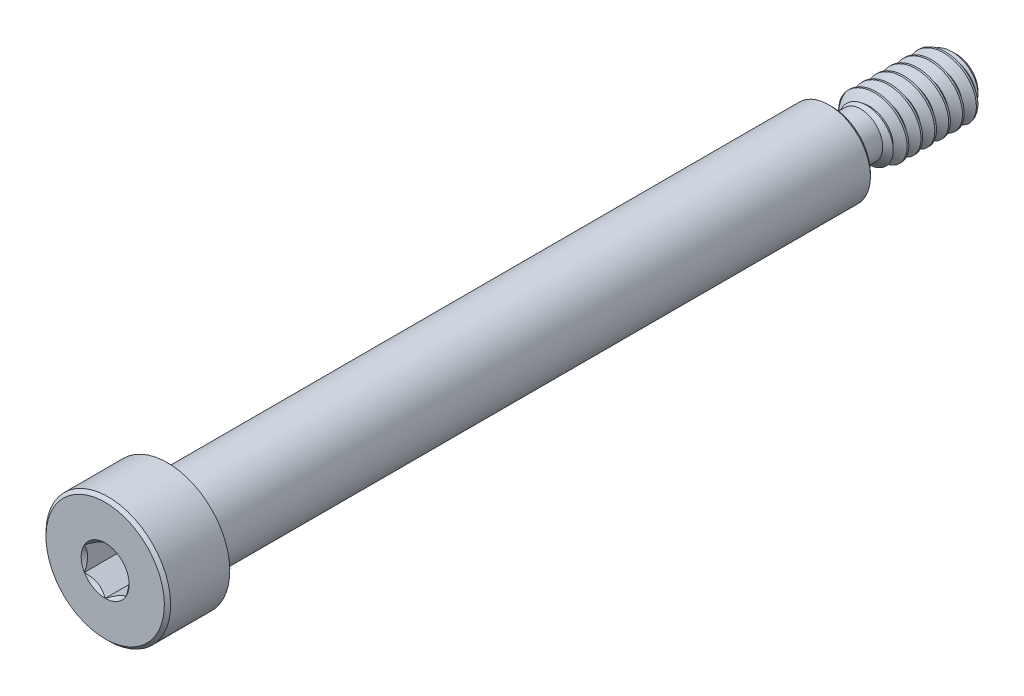
from build123d import *

# Parameters (mm, degrees)
CUT_EXTRUDE1_DEPTH = 3.571875
FILLET1_R          = 0.079375
CUT_SWEEP1_PITCH   = 1.058333333


with BuildPart() as part:
    # Sketch4 → Revolve1 (revolve)
    with BuildSketch(Plane(origin=(0, 0, 0), x_dir=(0, 0, -1), z_dir=(1, 0, 0)), mode=Mode.PRIVATE) as revolve1_sk:
        Polygon((-27.78125, 4.7625), (-32.305625, 4.7625), (-32.54375, 4.524375), (-32.54375, 0), (23.01875, 0), (23.01875, 2.921), (22.76475, 3.175), (-27.78125, 3.175), align=None)
    revolve(revolve1_sk.sketch.rotate(Axis((0, 0, 32.54375), (0, 0, -1)), 180), axis=Axis((0, 0, 32.54375), (0, 0, -1)))

    # Sketch5 → Cut-Extrude1 (cut)
    with BuildSketch(Plane.XY.offset(32.54375)):
        Polygon((1.5875, 0.916543552), (0, 1.833087105), (-1.5875, 0.916543552), (-1.5875, -0.916543552), (0, -1.833087105), (1.5875, -0.916543552), align=None)
    extrude(amount=-CUT_EXTRUDE1_DEPTH, mode=Mode.SUBTRACT)

    # Cut-Extrude4 cone 1 section (through the dimple's axis) → Cut-Extrude4 (revolve, cut)
    with BuildSketch(Plane(origin=(0, 0, 32.54375), x_dir=(0, -1, 0), z_dir=(1, 0, 0))):
        Polygon((0, 0), (1.833087105, 0), (0, 1.833087105), align=None)
    revolve(axis=Axis((0, 0, 32.54375), (0, 0, -1)), mode=Mode.SUBTRACT)

    # Sketch7 → Revolve2 (revolve)
    with BuildSketch(Plane(origin=(0, 0, 0), x_dir=(0, 0, -1), z_dir=(1, 0, 0))):
        Polygon((23.01875, 2.413), (31.75, 2.413), (32.54375, 1.61925), (32.54375, 0), (23.01875, 0), align=None)
    revolve(axis=Axis((0, 0, -32.54375), (0, 0, 1)))

    # Sketch10 → Cut-Revolve1 (revolve, cut)
    with BuildSketch(Plane(origin=(0, 0, 0), x_dir=(0, 0, -1), z_dir=(1, 0, 0))):
        with BuildLine():
            Line((23.3807, 1.6891), (25.1952125, 1.6891))
            Line((25.1952125, 1.6891), (26.6811125, 3.175))
            Line((26.6811125, 3.175), (23.01875, 3.175))
            Line((23.01875, 3.175), (23.01875, 2.05105))
            ThreePointArc((23.01875, 2.05105), (23.124762701, 1.795112701), (23.3807, 1.6891))
        make_face()
        Polygon((-27.78125, 3.175), (-27.46375, 3.175), (-27.6225, 3.01625), (-27.78125, 3.01625), align=None)
    revolve(axis=Axis((0, 0, -32.54375), (0, 0, 1)), mode=Mode.SUBTRACT)

    # Fillet1
    fillet1_edges = [part.edges().sort_by_distance(p)[0] for p in [
        (0, -3.01625, 27.78125),
    ]]
    fillet(fillet1_edges, radius=FILLET1_R)

    # Cut-Sweep1: the profile of Sketch9 screwed along a right-hand helix of 7.9435 turns, 8 arcs to a turn; built about Z, then put on its axis
    cut_sweep1_z = Axis((0, 0, 0), (0, 0, 1))
    cut_sweep1_corners = [(1.725592336, 0, -0.396875), (1.725592336, 0, -0.529166667), (2.470283972, 0, -0.959114583), (2.470283972, 0, 0.033072917)]
    with BuildLine(mode=Mode.PRIVATE) as cut_sweep1_profile:
        Line(cut_sweep1_corners[0], cut_sweep1_corners[1])
        Line(cut_sweep1_corners[1], cut_sweep1_corners[2])
        Line(cut_sweep1_corners[2], cut_sweep1_corners[3])
        Line(cut_sweep1_corners[3], cut_sweep1_corners[0])
    cut_sweep1_cap = Face(cut_sweep1_profile.wire())
    cut_sweep1_turn_angles = [0, 22.5, 45, 67.5, 90, 112.5, 135, 157.5, 180, 202.5, 225, 247.5, 270, 292.5, 315, 337.5, 360]
    cut_sweep1_turn_weights = [1, 0.9238795325112867, 1, 0.9238795325112867, 1, 0.9238795325112867, 1, 0.9238795325112867, 1, 0.9238795325112867, 1, 0.9238795325112867, 1, 0.9238795325112867, 1, 0.9238795325112867, 1]
    cut_sweep1_turn_rails = [Edge.make_bspline([Vector(p[0], p[1], 0).rotate(cut_sweep1_z, cut_sweep1_turn_angles[k]) / cut_sweep1_turn_weights[k] + Vector(0, 0, p[2] + CUT_SWEEP1_PITCH * cut_sweep1_turn_angles[k] / 360) for k in range(17)], [0, 0, 0, 1, 1, 2, 2, 3, 3, 4, 4, 5, 5, 6, 6, 7, 7, 8, 8, 8], 2, cut_sweep1_turn_weights) for p in cut_sweep1_corners]
    cut_sweep1_turn_sides = [Face.make_surface_from_curves(cut_sweep1_turn_rails[p[0]], cut_sweep1_turn_rails[p[1]]) for p in [(0, 1), (1, 2), (2, 3), (3, 0)]]
    cut_sweep1_last_angles = [2520, 2542.5, 2565, 2587.5, 2610, 2632.5, 2655, 2677.5, 2700, 2722.5, 2745, 2767.5, 2790, 2812.5, 2835, 2847.33, 2859.66]
    cut_sweep1_last_weights = [1, 0.9238795325112867, 1, 0.9238795325112867, 1, 0.9238795325112867, 1, 0.9238795325112867, 1, 0.9238795325112867, 1, 0.9238795325112867, 1, 0.9238795325112867, 1, 0.9769338980596829, 1]
    cut_sweep1_last_rails = [Edge.make_bspline([Vector(p[0], p[1], 0).rotate(cut_sweep1_z, cut_sweep1_last_angles[k]) / cut_sweep1_last_weights[k] + Vector(0, 0, p[2] + CUT_SWEEP1_PITCH * cut_sweep1_last_angles[k] / 360) for k in range(17)], [0, 0, 0, 1, 1, 2, 2, 3, 3, 4, 4, 5, 5, 6, 6, 7, 7, 8, 8, 8], 2, cut_sweep1_last_weights) for p in cut_sweep1_corners]
    cut_sweep1_last_sides = [Face.make_surface_from_curves(cut_sweep1_last_rails[p[0]], cut_sweep1_last_rails[p[1]]) for p in [(0, 1), (1, 2), (2, 3), (3, 0)]]
    cut_sweep1 = Plane(origin=(0, 0, -32.54375), x_dir=(0, 1, 0), z_dir=(0, 0, 1)) * Solid(Shell([*[p.moved(Location((0, 0, CUT_SWEEP1_PITCH * i))) for i in range(7) for p in cut_sweep1_turn_sides], *cut_sweep1_last_sides, cut_sweep1_cap, cut_sweep1_cap.rotate(cut_sweep1_z, 2859.66).moved(Location((0, 0, CUT_SWEEP1_PITCH * 2859.66 / 360)))]))
    add(cut_sweep1, mode=Mode.SUBTRACT)


solid = part.part
